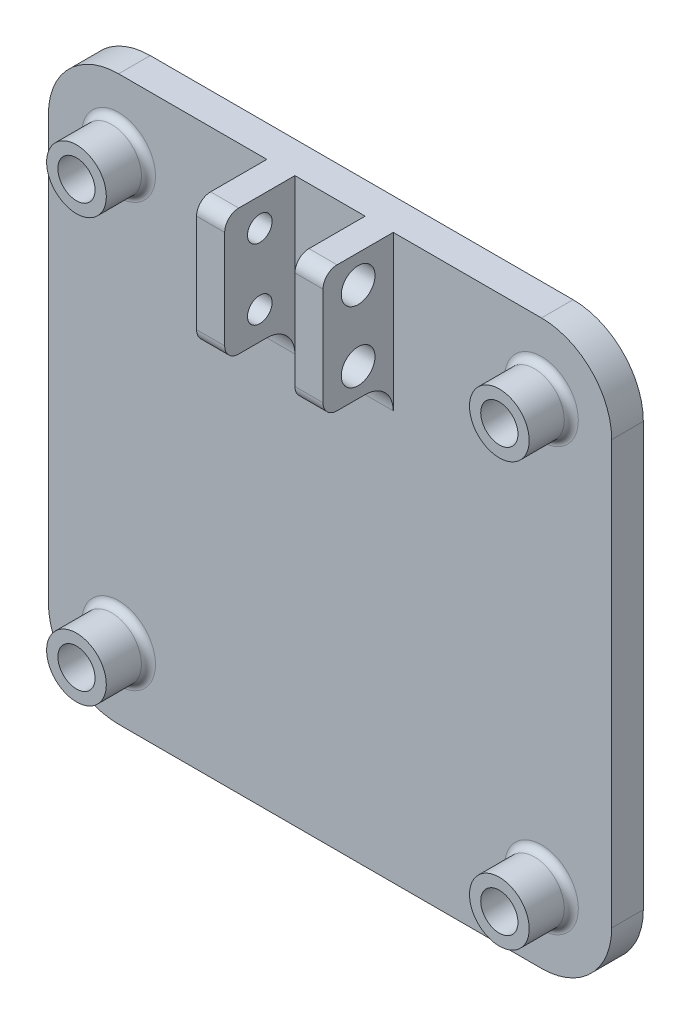
from build123d import *

# Parameters (mm, degrees)
SKETCH1_W            = 80.2
SKETCH1_H            = 80.2
BOSS_EXTRUDE1_DEPTH  = 4.5
M5_CLEARANCE_HOLE1_D = 5.3
FILLET1_R            = 10
SKETCH3_W            = 4
SKETCH3_H            = 18
BOSS_EXTRUDE2_DEPTH  = 10
CUT_EXTRUDE1_REACH   = 67.031
SKETCH5_R            = 2.4
CUT_EXTRUDE2_REACH   = 67.031
SKETCH6_R            = 1.75
FILLET2_R            = 2
FILLET3_R            = 4
BOSS_EXTRUDE3_START  = 6
SKETCH7_R            = 4.25
SKETCH7_R_2          = 2.65
BOSS_EXTRUDE3_DEPTH  = 6
FILLET5_R            = 1


with BuildPart() as part:
    # Sketch1 → Boss-Extrude1 (new body)
    with BuildSketch(Plane.XY):
        Rectangle(SKETCH1_W, SKETCH1_H)
    extrude(amount=BOSS_EXTRUDE1_DEPTH)

    # M5 Clearance Hole1 (through all)
    with Locations(Plane(origin=(30.1, 30.1, 0), x_dir=(-1, 0, 0), z_dir=(0, 0, -1))):
        with Locations((0, 0), (60.2, 0), (60.2, -60.2), (0, -60.2)):
            Hole(M5_CLEARANCE_HOLE1_D / 2)

    # Fillet1
    fillet1_edges = [part.edges().sort_by_distance(p)[0] for p in [
        (-40.1, 40.1, 2.25),
        (-40.1, -40.1, 2.25),
        (40.1, -40.1, 2.25),
        (40.1, 40.1, 2.25),
    ]]
    fillet(fillet1_edges, radius=FILLET1_R)

    # Sketch3 → Boss-Extrude2 (add)
    with BuildSketch(Plane.XY.offset(4.5)):
        with Locations((-7, 31.1)):
            Rectangle(SKETCH3_W, SKETCH3_H)
        with Locations((7, 31.1)):
            Rectangle(SKETCH3_W, SKETCH3_H)
    extrude(amount=BOSS_EXTRUDE2_DEPTH)

    # Sketch5 → Cut-Extrude1 (cut, up to next)
    with BuildSketch(Plane(origin=(9, 0, 0), x_dir=(0, 0, -1), z_dir=(1, 0, 0)), mode=Mode.PRIVATE) as cut_extrude1_sk1:
        with Locations((-9.5, 36.1)):
            Circle(SKETCH5_R)
    cut_extrude1_tool1 = extrude(cut_extrude1_sk1.sketch, amount=-CUT_EXTRUDE1_REACH, mode=Mode.PRIVATE) & part.part
    # Sketch5 → Cut-Extrude1 (cut, up to next)
    with BuildSketch(Plane(origin=(9, 0, 0), x_dir=(0, 0, -1), z_dir=(1, 0, 0)), mode=Mode.PRIVATE) as cut_extrude1_sk2:
        with Locations((-9.5, 26.1)):
            Circle(SKETCH5_R)
    cut_extrude1_tool2 = extrude(cut_extrude1_sk2.sketch, amount=-CUT_EXTRUDE1_REACH, mode=Mode.PRIVATE) & part.part
    add(cut_extrude1_tool1.solids().sort_by_distance((9, 36.1, 9.5))[0], mode=Mode.SUBTRACT)
    add(cut_extrude1_tool2.solids().sort_by_distance((9, 26.1, 9.5))[0], mode=Mode.SUBTRACT)

    # Sketch6 → Cut-Extrude2 (cut, up to next)
    with BuildSketch(Plane.ZY.offset(9), mode=Mode.PRIVATE) as cut_extrude2_sk1:
        with Locations((9.5, 36.1)):
            Circle(SKETCH6_R)
    cut_extrude2_tool1 = extrude(cut_extrude2_sk1.sketch, amount=-CUT_EXTRUDE2_REACH, mode=Mode.PRIVATE) & part.part
    # Sketch6 → Cut-Extrude2 (cut, up to next)
    with BuildSketch(Plane.ZY.offset(9), mode=Mode.PRIVATE) as cut_extrude2_sk2:
        with Locations((9.5, 26.1)):
            Circle(SKETCH6_R)
    cut_extrude2_tool2 = extrude(cut_extrude2_sk2.sketch, amount=-CUT_EXTRUDE2_REACH, mode=Mode.PRIVATE) & part.part
    add(cut_extrude2_tool1.solids().sort_by_distance((-9, 36.1, 9.5))[0], mode=Mode.SUBTRACT)
    add(cut_extrude2_tool2.solids().sort_by_distance((-9, 26.1, 9.5))[0], mode=Mode.SUBTRACT)

    # Fillet2
    fillet2_edges = [part.edges().sort_by_distance(p)[0] for p in [
        (-7, 22.1, 14.5),
        (7, 22.1, 14.5),
        (7, 40.1, 14.5),
        (-7, 40.1, 14.5),
    ]]
    fillet(fillet2_edges, radius=FILLET2_R)

    # Fillet3
    fillet3_edges = [part.edges().sort_by_distance(p)[0] for p in [
        (7, 22.1, 4.5),
        (-7, 22.1, 4.5),
    ]]
    fillet(fillet3_edges, radius=FILLET3_R)

    # Sketch7 → Boss-Extrude3 (add)
    # profile 1 of 4: a face of its own
    with BuildSketch(Plane.XY.offset(4.5).offset(BOSS_EXTRUDE3_START)):
        with Locations((-30.1, 30.1)):
            Circle(SKETCH7_R)
        with Locations((-30.1, 30.1)):
            Circle(SKETCH7_R_2, mode=Mode.SUBTRACT)
    # profile 2 of 4: a face of its own
    with BuildSketch(Plane.XY.offset(4.5).offset(BOSS_EXTRUDE3_START)):
        with Locations((30.1, 30.1)):
            Circle(SKETCH7_R)
        with Locations((30.1, 30.1)):
            Circle(SKETCH7_R_2, mode=Mode.SUBTRACT)
    # profile 3 of 4: a face of its own
    with BuildSketch(Plane.XY.offset(4.5).offset(BOSS_EXTRUDE3_START)):
        with Locations((30.1, -30.1)):
            Circle(SKETCH7_R)
        with Locations((30.1, -30.1)):
            Circle(SKETCH7_R_2, mode=Mode.SUBTRACT)
    # profile 4 of 4: a face of its own
    with BuildSketch(Plane.XY.offset(4.5).offset(BOSS_EXTRUDE3_START)):
        with Locations((-30.1, -30.1)):
            Circle(SKETCH7_R)
        with Locations((-30.1, -30.1)):
            Circle(SKETCH7_R_2, mode=Mode.SUBTRACT)
    extrude(amount=-BOSS_EXTRUDE3_DEPTH)

    # Fillet5
    fillet5_edges = [part.edges().sort_by_distance(p)[0] for p in [
        (25.85, 30.1, 4.5),
        (25.85, -30.1, 4.5),
        (-34.35, -30.1, 4.5),
        (-34.35, 30.1, 4.5),
    ]]
    fillet(fillet5_edges, radius=FILLET5_R)


solid = part.part
